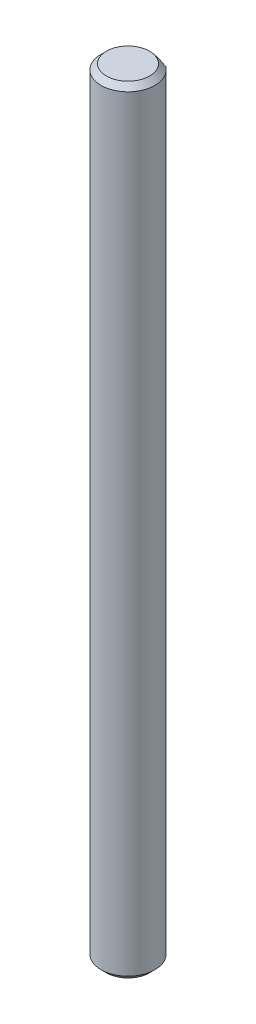
from build123d import *

# Parameters (mm, degrees)
SKETCH_1_R          = 2.5
EXTRUDE_1_DEPTH     = 72
CUT_EXTRUDE_START   = -15
CUT_EXTRUDE_1_DEPTH = 15
CHAMFER_1_SIZE      = 0.5


with BuildPart() as part:
    # Эскиз1 → Бобышка-Вытянуть1 (new body)
    with BuildSketch(Plane(origin=(0, 0, 0), x_dir=(1, 0, 0), z_dir=(0, 1, 0))):
        with Locations(Location((0, 0, 0), (0, 0, 270))):
            Circle(SKETCH_1_R)
    extrude(amount=EXTRUDE_1_DEPTH)

    # Эскиз2 → Вырез-Вытянуть1 (cut)
    with BuildSketch(Plane(origin=(0, 72, 0), x_dir=(1, 0, 0), z_dir=(0, 1, 0)).offset(CUT_EXTRUDE_START)):
        with BuildLine():
            Line((-1.5, 2), (1.5, 2))
            ThreePointArc((1.5, 2), (0, 2.5), (-1.5, 2))
        make_face()
    extrude(amount=CUT_EXTRUDE_1_DEPTH, mode=Mode.SUBTRACT)

    # Фаска1
    chamfer_1_edges = [part.edges().sort_by_distance(p)[0] for p in [
        (-2.371708245, 72, 0.790569415),
        (0, 0, -2.5),
    ]]
    chamfer(chamfer_1_edges, length=CHAMFER_1_SIZE - 0.0001)  # a hair under: the kernel refuses the full size


solid = part.part
